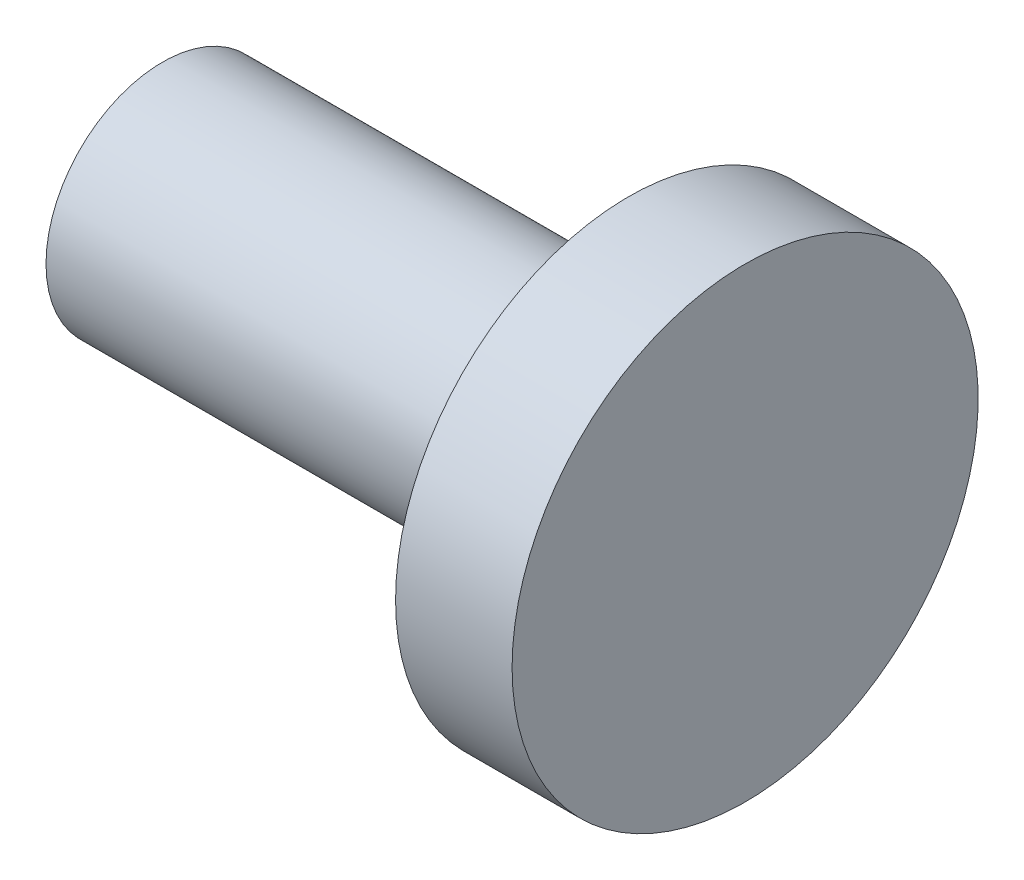
from build123d import *
from build123d.topology import SkipClean

# Parameters (mm, degrees)
IZIM3_R               = 4
KES_EKSTR_ZYON1_DEPTH = 20
DI_1_PITCH            = 1.5


with BuildPart() as part:
    # Çizim1 → Döndür1 (revolve)
    with BuildSketch(Plane.XY, mode=Mode.PRIVATE) as d_nd_r1_sk:
        Polygon((21.298203691, 0), (21.298203691, 10), (16.298203691, 10), (16.298203691, 5), (-3.701796309, 5), (-3.701796309, 0), align=None)
    revolve(d_nd_r1_sk.sketch.rotate(Axis((-3.701796309, 0, 0), (1, 0, 0)), 90), axis=Axis((-3.701796309, 0, 0), (1, 0, 0)))

    # Çizim3 → Kes-Ekstrüzyon1 (cut)
    with BuildSketch(Plane.ZY.offset(3.701796309)):
        Circle(IZIM3_R)
    extrude(amount=-KES_EKSTR_ZYON1_DEPTH, mode=Mode.SUBTRACT)

    # Diş1: the profile of Diş Profili1 profile screwed along a right-hand helix of 13.333333 turns, 8 arcs to a turn; built about Z, then put on its axis
    with SkipClean():  # the faces are left unmerged after this step: merging them gives an invalid solid
        di_1_z = Axis((0, 0, 0), (0, 0, 1))
        di_1_corners = [(3.9997, 0, -0.000173205), (4.811898812, 0, 0.468749998), (4.811898812, 0, 0.656249998), (3.9997, 0, 1.125173201)]
        with BuildLine(mode=Mode.PRIVATE) as di_1_profile:
            Line(di_1_corners[0], di_1_corners[1])
            Line(di_1_corners[1], di_1_corners[2])
            Line(di_1_corners[2], di_1_corners[3])
            Line(di_1_corners[3], di_1_corners[0])
        di_1_cap = Face(di_1_profile.wire())
        di_1_turn_angles = [0, 22.5, 45, 67.5, 90, 112.5, 135, 157.5, 180, 202.5, 225, 247.5, 270, 292.5, 315, 337.5, 360]
        di_1_turn_weights = [1, 0.9238795325112867, 1, 0.9238795325112867, 1, 0.9238795325112867, 1, 0.9238795325112867, 1, 0.9238795325112867, 1, 0.9238795325112867, 1, 0.9238795325112867, 1, 0.9238795325112867, 1]
        di_1_turn_rails = [Edge.make_bspline([Vector(p[0], p[1], 0).rotate(di_1_z, di_1_turn_angles[k]) / di_1_turn_weights[k] + Vector(0, 0, p[2] + DI_1_PITCH * di_1_turn_angles[k] / 360) for k in range(17)], [0, 0, 0, 1, 1, 2, 2, 3, 3, 4, 4, 5, 5, 6, 6, 7, 7, 8, 8, 8], 2, di_1_turn_weights) for p in di_1_corners]
        di_1_turn_sides = [Face.make_surface_from_curves(di_1_turn_rails[p[0]], di_1_turn_rails[p[1]]) for p in [(0, 1), (1, 2), (2, 3), (3, 0)]]
        di_1_last_angles = [4680, 4702.5, 4725, 4747.5, 4770, 4785, 4800]
        di_1_last_weights = [1, 0.9238795325112867, 1, 0.9238795325112867, 1, 0.9659258262890703, 1]
        di_1_last_rails = [Edge.make_bspline([Vector(p[0], p[1], 0).rotate(di_1_z, di_1_last_angles[k]) / di_1_last_weights[k] + Vector(0, 0, p[2] + DI_1_PITCH * di_1_last_angles[k] / 360) for k in range(7)], [0, 0, 0, 1, 1, 2, 2, 3, 3, 3], 2, di_1_last_weights) for p in di_1_corners]
        di_1_last_sides = [Face.make_surface_from_curves(di_1_last_rails[p[0]], di_1_last_rails[p[1]]) for p in [(0, 1), (1, 2), (2, 3), (3, 0)]]
        di_1 = Plane(origin=(-3.701796309, 0, 0), x_dir=(0, 0, -1), z_dir=(1, 0, 0)) * Solid(Shell([*[p.moved(Location((0, 0, DI_1_PITCH * i))) for i in range(13) for p in di_1_turn_sides], *di_1_last_sides, di_1_cap, di_1_cap.rotate(di_1_z, 4800).moved(Location((0, 0, DI_1_PITCH * 4800 / 360)))]))
        add(di_1, mode=Mode.SUBTRACT)


solid = part.part
